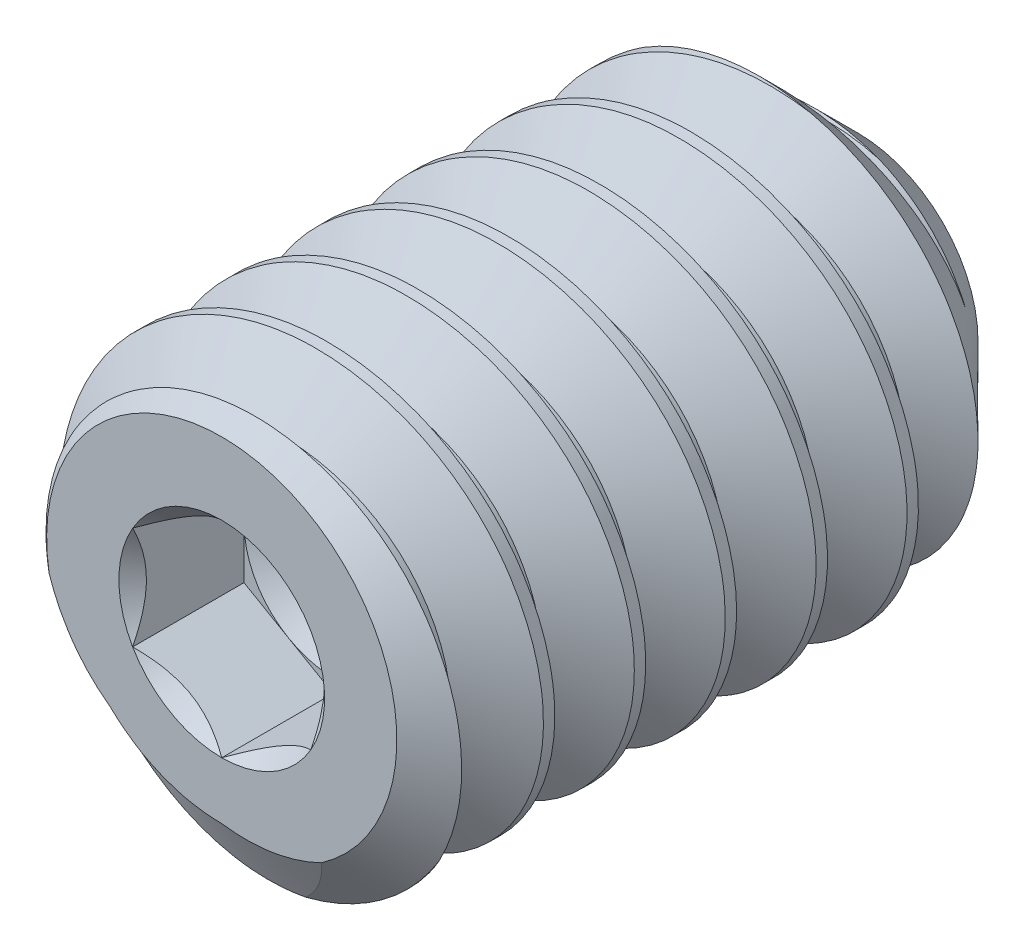
from build123d import *

# Parameters (mm, degrees)
CUT_SWEEP2_PITCH    = 0.453571429
CUT_EXTRUDE10_DEPTH = 0.555625


with BuildPart() as part:
    # Sketch22 → Revolve1 (revolve)
    with BuildSketch(Plane(origin=(0, 0, 0), x_dir=(0, 0, -1), z_dir=(1, 0, 0)), mode=Mode.PRIVATE) as revolve1_sk:
        Polygon((-1.407696284, 0), (-1.407696284, 0.87376), (-1.254742949, 1.0922), (1.273590987, 1.0922), (1.767303716, 0.598487271), (1.407696284, 0), align=None)
    revolve(revolve1_sk.sketch.rotate(Axis((0, 0, -1.407696284), (0, 0, -1)), 180), axis=Axis((0, 0, -1.407696284), (0, 0, -1)))

    # Cut-Sweep2: the profile of Sketch28 profile screwed along a right-hand helix of 8 turns, 6 arcs to a turn; built about Z, then put on its axis
    cut_sweep2_z = Axis((0, 0, 0), (0, 0, 1))
    cut_sweep2_corners = [(1.0925, 0, 0.000173205), (1.0925, 0, -0.397048205), (0.797596715, 0, -0.226785714), (0.797596715, 0, -0.170089286)]
    with BuildLine(mode=Mode.PRIVATE) as cut_sweep2_profile:
        Line(cut_sweep2_corners[0], cut_sweep2_corners[1])
        Line(cut_sweep2_corners[1], cut_sweep2_corners[2])
        Line(cut_sweep2_corners[2], cut_sweep2_corners[3])
        Line(cut_sweep2_corners[3], cut_sweep2_corners[0])
    cut_sweep2_cap = Face(cut_sweep2_profile.wire())
    cut_sweep2_turn_angles = [0, 30, 60, 90, 120, 150, 180, 210, 240, 270, 300, 330, 360]
    cut_sweep2_turn_weights = [1, 0.8660254037844387, 1, 0.8660254037844387, 1, 0.8660254037844387, 1, 0.8660254037844387, 1, 0.8660254037844387, 1, 0.8660254037844387, 1]
    cut_sweep2_turn_rails = [Edge.make_bspline([Vector(p[0], p[1], 0).rotate(cut_sweep2_z, cut_sweep2_turn_angles[k]) / cut_sweep2_turn_weights[k] + Vector(0, 0, p[2] + CUT_SWEEP2_PITCH * cut_sweep2_turn_angles[k] / 360) for k in range(13)], [0, 0, 0, 1, 1, 2, 2, 3, 3, 4, 4, 5, 5, 6, 6, 6], 2, cut_sweep2_turn_weights) for p in cut_sweep2_corners]
    cut_sweep2_turn_sides = [Face.make_surface_from_curves(cut_sweep2_turn_rails[p[0]], cut_sweep2_turn_rails[p[1]]) for p in [(0, 1), (1, 2), (2, 3), (3, 0)]]
    cut_sweep2 = Plane(origin=(0, 0, -1.767303716), x_dir=(0, 1, 0), z_dir=(0, 0, 1)) * Solid(Shell([*[p.moved(Location((0, 0, CUT_SWEEP2_PITCH * i))) for i in range(8) for p in cut_sweep2_turn_sides], cut_sweep2_cap, cut_sweep2_cap.rotate(cut_sweep2_z, 2880).moved(Location((0, 0, CUT_SWEEP2_PITCH * 2880 / 360)))]))
    add(cut_sweep2, mode=Mode.SUBTRACT)

    # Sketch23 → Cut-Extrude10 (cut)
    with BuildSketch(Plane.XY.offset(1.407696284)):
        Polygon((0, 0.513264389), (-0.4445, 0.256632195), (-0.4445, -0.256632195), (0, -0.513264389), (0.4445, -0.256632195), (0.4445, 0.256632195), align=None)
    extrude(amount=-CUT_EXTRUDE10_DEPTH, mode=Mode.SUBTRACT)

    # Cut-Extrude11 cone 1 section (through the dimple's axis) → Cut-Extrude11 (revolve, cut)
    with BuildSketch(Plane(origin=(0, 0, 1.407696284), x_dir=(0, -1, 0), z_dir=(1, 0, 0))):
        Polygon((0, 0), (0.513264389, 0), (0, 0.513264389), align=None)
    revolve(axis=Axis((0, 0, 1.407696284), (0, 0, -1)), mode=Mode.SUBTRACT)

    # Cut-Extrude12 cone 1 section (through the dimple's axis) → Cut-Extrude12 (revolve, cut)
    with BuildSketch(Plane(origin=(0, 0, 0.852071284), x_dir=(0, -1, 0), z_dir=(1, 0, 0))):
        Polygon((0, 0), (0.4445, 0), (0, 0.256632195), align=None)
    revolve(axis=Axis((0, 0, 0.852071284), (0, 0, -1)), mode=Mode.SUBTRACT)


solid = part.part
